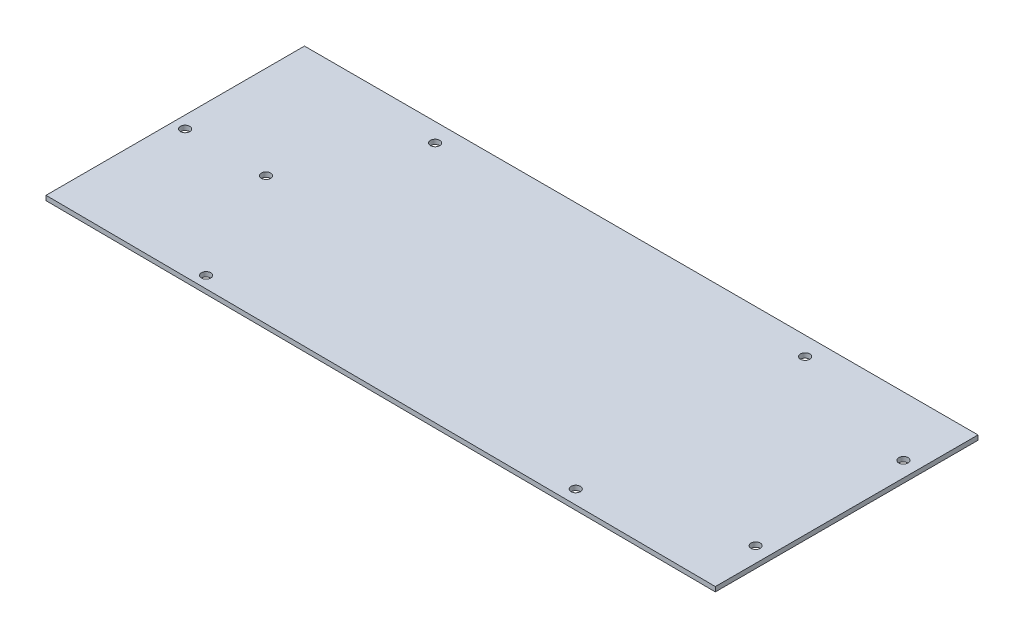
from build123d import *

# Parameters (mm, degrees)
SKETCH1_R           = 3
BOSS_EXTRUDE1_DEPTH = 3


with BuildPart() as part:
    # Sketch1 → Boss-Extrude1 (new body)
    with BuildSketch(Plane(origin=(0, 0, 0), x_dir=(1, 0, 0), z_dir=(0, 1, 0))):
        Polygon((489.275803395, -599.726550428), (489.275803395, -563.091000236), (489.275803395, -497.980368051), (56.000702368, -497.980368051), (56.000702368, -664.256774185), (489.275803395, -666.94592043), align=None)
        with Locations((63.795566368, -582.563569341)):
            Circle(SKETCH1_R, mode=Mode.SUBTRACT)
        with Locations((115.846397689, -582.563569341)):
            Circle(SKETCH1_R, mode=Mode.SUBTRACT)
        with Locations((152.014490623, -509.955660754)):
            Circle(SKETCH1_R, mode=Mode.SUBTRACT)
        with Locations((152.113129711, -657.377281332)):
            Circle(SKETCH1_R, mode=Mode.SUBTRACT)
        with Locations((390.014490623, -657.493569341)):
            Circle(SKETCH1_R, mode=Mode.SUBTRACT)
        with Locations((479.47492472, -631.223569341)):
            Circle(SKETCH1_R, mode=Mode.SUBTRACT)
        with Locations((479.422490623, -536.117660754)):
            Circle(SKETCH1_R, mode=Mode.SUBTRACT)
        with Locations((390.014490623, -509.955660754)):
            Circle(SKETCH1_R, mode=Mode.SUBTRACT)
    extrude(amount=BOSS_EXTRUDE1_DEPTH)


solid = part.part
